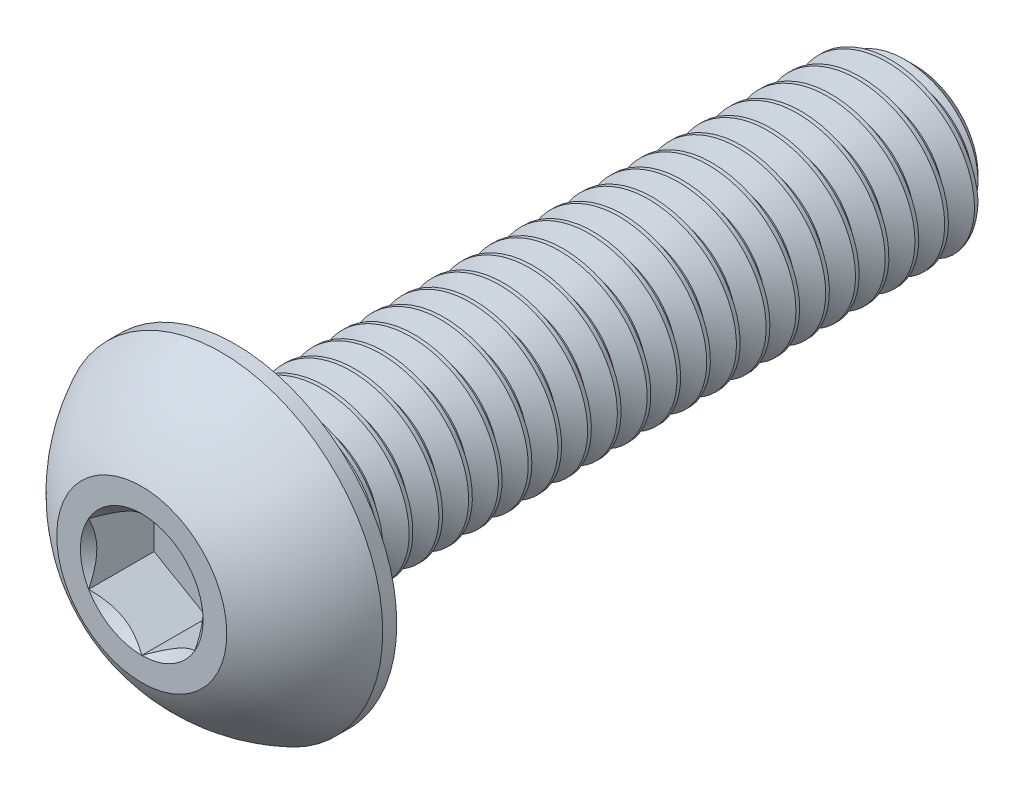
from build123d import *

# Parameters (mm, degrees)
SKETCH1_W              = 16
SKETCH1_H              = 2
CUT_EXTRUDE2_DEPTH     = 1.54
SPLIT1_SURFACE_1_BACK  = 22.137
SPLIT1_SURFACE_1_DEPTH = 44.274
SPLIT1_SURFACE_2_BACK  = 22.137
SPLIT1_SURFACE_2_DEPTH = 44.274
CHAMFER1_SIZE          = 0.525
CUT_SWEEP1_PITCH       = 0.7
CUT_SWEEP1_TO          = 16


with BuildPart() as part:
    # Sketch1 → Revolve1 (revolve)
    with BuildSketch(Plane(origin=(0, 0, 0), x_dir=(0, 0, -1), z_dir=(1, 0, 0))):
        with Locations((10.2, 1)):
            Rectangle(SKETCH1_W, SKETCH1_H)
    revolve(axis=Axis((0, 0, -18.2), (0, 0, 1)))

    # Sketch7 → Revolve2 (revolve)
    with BuildSketch(Plane(origin=(0, 0, 0), x_dir=(0, 0, -1), z_dir=(1, 0, 0)), mode=Mode.PRIVATE) as revolve2_sk:
        with BuildLine():
            Line((1.87, 3.8), (2.2, 3.8))
            Line((2.2, 3.8), (2.2, 0))
            Line((2.2, 0), (0, 0))
            Line((0, 0), (0, 2))
            ThreePointArc((0, 2), (0.793500147, 3.047002626), (1.87, 3.8))
        make_face()
    revolve(revolve2_sk.sketch.rotate(Axis((0, 0, 0), (0, 0, -1)), 180), axis=Axis((0, 0, 0), (0, 0, -1)))

    # Sketch5 → Cut-Extrude2 (cut)
    with BuildSketch(Plane.XY):
        Polygon((1.25, -0.721687836), (1.25, 0.721687836), (0, 1.443375673), (-1.25, 0.721687836), (-1.25, -0.721687836), (0, -1.443375673), align=None)
    extrude(amount=-CUT_EXTRUDE2_DEPTH, mode=Mode.SUBTRACT)

    # Cut-Extrude3 cone 1 section (through the dimple's axis) → Cut-Extrude3 (revolve, cut)
    with BuildSketch(Plane(origin=(0, 0, 0), x_dir=(0, -1, 0), z_dir=(1, 0, 0))):
        Polygon((0, 0), (1.443375673, 0), (0, 1.443375673), align=None)
    revolve(axis=Axis((0, 0, 0), (0, 0, -1)), mode=Mode.SUBTRACT)


with BuildPart() as body_2:
    # Split1: the piece behind the surface
    add(part.part)
    # Split1 surface: a surface, the sketch's curves swept straight by 44.274 mm
    with BuildLine(Plane(origin=(0, 0, 0), x_dir=(0, 0, -1), z_dir=(1, 0, 0)).offset(-SPLIT1_SURFACE_1_BACK), mode=Mode.PRIVATE) as split1_surface_1_path:
        Line((2.2, -3.8), (2.2, 3.8))
    split1_surface_1 = Shell.extrude(split1_surface_1_path.wire(), (1 * SPLIT1_SURFACE_1_DEPTH, 0 * SPLIT1_SURFACE_1_DEPTH, 0 * SPLIT1_SURFACE_1_DEPTH))
    split(bisect_by=split1_surface_1, keep=Keep.BOTTOM)

    # Chamfer1
    chamfer1_edges = [body_2.edges().sort_by_distance(p)[0] for p in [
        (0, -2, -18.2),
    ]]
    chamfer(chamfer1_edges, length=CHAMFER1_SIZE)

    # Cut-Sweep1: arcs per turn and ends read off the stored shape
    # Cut-Sweep1: the profile of Sketch2 screwed along a right-hand helix through 23.857143 turns, 6 arcs to a turn; built about Z, then put on its axis
    cut_sweep1_z = Axis((0, 0, 0), (0, 0, 1))
    cut_sweep1_corners = [(1.545336663, 0, -0.2625), (1.545336663, 0, -0.35), (2.037888611, 0, -0.634375), (2.037888611, 0, 0.021875)]
    with BuildLine(mode=Mode.PRIVATE) as cut_sweep1_profile:
        Line(cut_sweep1_corners[0], cut_sweep1_corners[1])
        Line(cut_sweep1_corners[1], cut_sweep1_corners[2])
        Line(cut_sweep1_corners[2], cut_sweep1_corners[3])
        Line(cut_sweep1_corners[3], cut_sweep1_corners[0])
    cut_sweep1_cap = Face(cut_sweep1_profile.wire())
    cut_sweep1_turn_angles = [0, 30, 60, 90, 120, 150, 180, 210, 240, 270, 300, 330, 360]
    cut_sweep1_turn_weights = [1, 0.8660254037844387, 1, 0.8660254037844387, 1, 0.8660254037844387, 1, 0.8660254037844387, 1, 0.8660254037844387, 1, 0.8660254037844387, 1]
    cut_sweep1_turn_rails = [Edge.make_bspline([Vector(p[0], p[1], 0).rotate(cut_sweep1_z, cut_sweep1_turn_angles[k]) / cut_sweep1_turn_weights[k] + Vector(0, 0, p[2] + CUT_SWEEP1_PITCH * cut_sweep1_turn_angles[k] / 360) for k in range(13)], [0, 0, 0, 1, 1, 2, 2, 3, 3, 4, 4, 5, 5, 6, 6, 6], 2, cut_sweep1_turn_weights) for p in cut_sweep1_corners]
    cut_sweep1_turn_sides = [Face.make_surface_from_curves(cut_sweep1_turn_rails[p[0]], cut_sweep1_turn_rails[p[1]]) for p in [(0, 1), (1, 2), (2, 3), (3, 0)]]
    cut_sweep1_last_angles = [8280, 8310, 8340, 8370, 8400, 8430, 8460, 8490, 8520, 8550, 8580, 8584.285714286, 8588.571428571]
    cut_sweep1_last_weights = [1, 0.8660254037844387, 1, 0.8660254037844387, 1, 0.8660254037844387, 1, 0.8660254037844387, 1, 0.8660254037844387, 1, 0.9972037971812046, 1]
    cut_sweep1_last_rails = [Edge.make_bspline([Vector(p[0], p[1], 0).rotate(cut_sweep1_z, cut_sweep1_last_angles[k]) / cut_sweep1_last_weights[k] + Vector(0, 0, p[2] + CUT_SWEEP1_PITCH * cut_sweep1_last_angles[k] / 360) for k in range(13)], [0, 0, 0, 1, 1, 2, 2, 3, 3, 4, 4, 5, 5, 6, 6, 6], 2, cut_sweep1_last_weights) for p in cut_sweep1_corners]
    cut_sweep1_last_sides = [Face.make_surface_from_curves(cut_sweep1_last_rails[p[0]], cut_sweep1_last_rails[p[1]]) for p in [(0, 1), (1, 2), (2, 3), (3, 0)]]
    cut_sweep1 = Plane(origin=(0, 0, -18.2), x_dir=(0, 1, 0), z_dir=(0, 0, 1)) * split(Solid(Shell([*[p.moved(Location((0, 0, CUT_SWEEP1_PITCH * i))) for i in range(23) for p in cut_sweep1_turn_sides], *cut_sweep1_last_sides, cut_sweep1_cap, cut_sweep1_cap.rotate(cut_sweep1_z, 8588.571428571).moved(Location((0, 0, CUT_SWEEP1_PITCH * 8588.571428571 / 360)))])), bisect_by=Plane.XY.offset(CUT_SWEEP1_TO), keep=Keep.BOTTOM, mode=Mode.PRIVATE)
    add(cut_sweep1, mode=Mode.SUBTRACT)


with BuildPart() as part_1:
    add(part.part)

    # Split1: split by a surface, the side it looks to stays
    # Split1 surface: a surface, the sketch's curves swept straight by 44.274 mm
    with BuildLine(Plane(origin=(0, 0, 0), x_dir=(0, 0, -1), z_dir=(1, 0, 0)).offset(-SPLIT1_SURFACE_2_BACK), mode=Mode.PRIVATE) as split1_surface_2_path:
        Line((2.2, -3.8), (2.2, 3.8))
    split1_surface_2 = Shell.extrude(split1_surface_2_path.wire(), (1 * SPLIT1_SURFACE_2_DEPTH, 0 * SPLIT1_SURFACE_2_DEPTH, 0 * SPLIT1_SURFACE_2_DEPTH))
    split(bisect_by=split1_surface_2, keep=Keep.TOP)

    # Combine1: union body 2
    add(body_2.part)


solid = part_1.part
